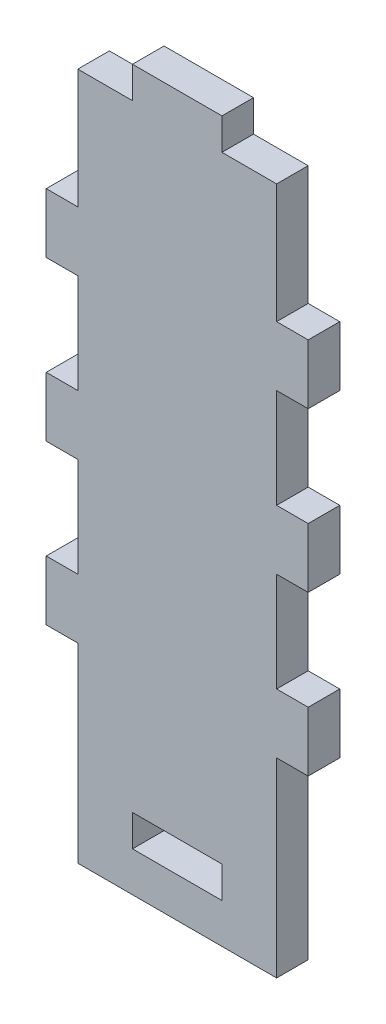
from build123d import *

# Parameters (mm, degrees)
BOSS_EXTRUDE2_DEPTH = 1.5875


with BuildPart() as part:
    # Sketch1 → Boss-Extrude2 (new, symmetric)
    with BuildSketch(Plane.XY):
        Polygon((0, 7.175), (0, 19.175), (3.175, 19.175), (3.175, 25.175), (0, 25.175), (0, 35.175), (3.175, 35.175), (3.175, 41.175), (0, 41.175), (0, 51.175), (3.175, 51.175), (3.175, 57.175), (0, 57.175), (0, 69.175), (-5.5, 69.175), (-5.5, 72.35), (-14.5, 72.35), (-14.5, 69.175), (-20, 69.175), (-20, 57.175), (-23.175, 57.175), (-23.175, 51.175), (-20, 51.175), (-20, 41.175), (-23.175, 41.175), (-23.175, 35.175), (-20, 35.175), (-20, 25.175), (-23.175, 25.175), (-23.175, 19.175), (-20, 19.175), (-20, 7.175), (-20, 0), (-10, 0), (0, 0), align=None)
        Polygon((-5.5, 4), (-10, 4), (-14.5, 4), (-14.5, 7.175), (-5.5, 7.175), align=None, mode=Mode.SUBTRACT)
    extrude(amount=BOSS_EXTRUDE2_DEPTH, both=True)


solid = part.part
